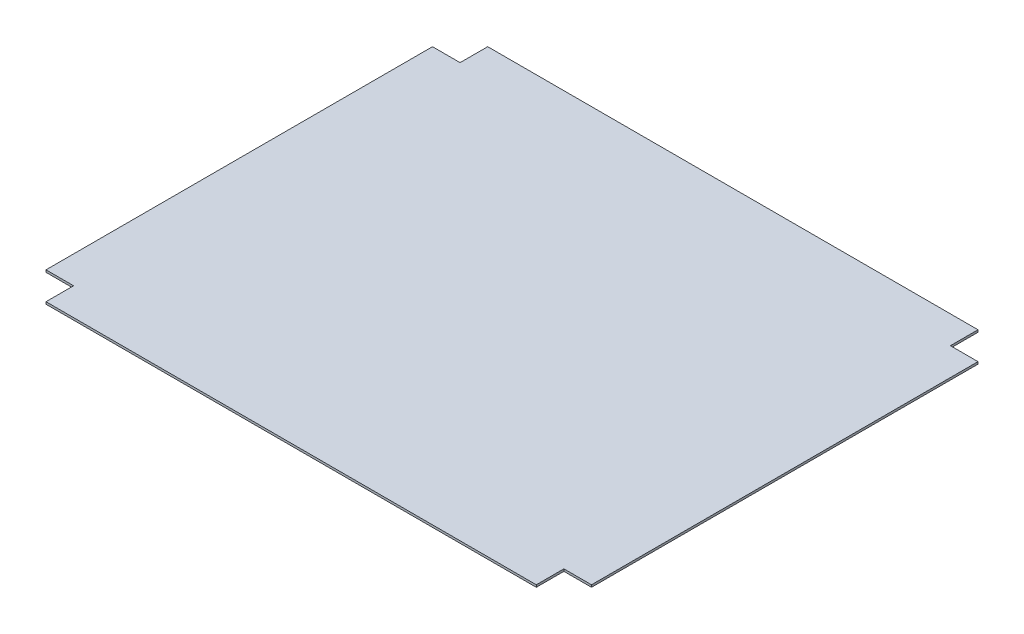
from build123d import *

# Parameters (mm, degrees)
IZIM1_W               = 494
IZIM1_H               = 400
TABAN_FLAN_1_DEPTH    = 2
IZIM6_W               = 25
IZIM6_H               = 25
KES_EKSTR_ZYON1_DEPTH = 10


# Sheet-metal steps are written as plain solids
with BuildPart() as part:
    # Çizim1 → Taban-Flanş1 (new body)
    with BuildSketch(Plane(origin=(0, 0, 0), x_dir=(1, 0, 0), z_dir=(0, 1, 0))):
        with Locations((0, 200)):
            Rectangle(IZIM1_W, IZIM1_H)
    extrude(amount=-TABAN_FLAN_1_DEPTH)

    # Çizim6 → Kes-Ekstrüzyon1 (cut)
    with BuildSketch(Plane.XZ.offset(2)):
        with Locations((-234.5, -12.5)):
            Rectangle(IZIM6_W, IZIM6_H)
        with Locations((234.5, -12.5)):
            Rectangle(IZIM6_W, IZIM6_H)
        with Locations((234.5, -387.5)):
            Rectangle(IZIM6_W, IZIM6_H)
        with Locations((-234.5, -387.5)):
            Rectangle(IZIM6_W, IZIM6_H)
    extrude(amount=-KES_EKSTR_ZYON1_DEPTH, mode=Mode.SUBTRACT)


solid = part.part
